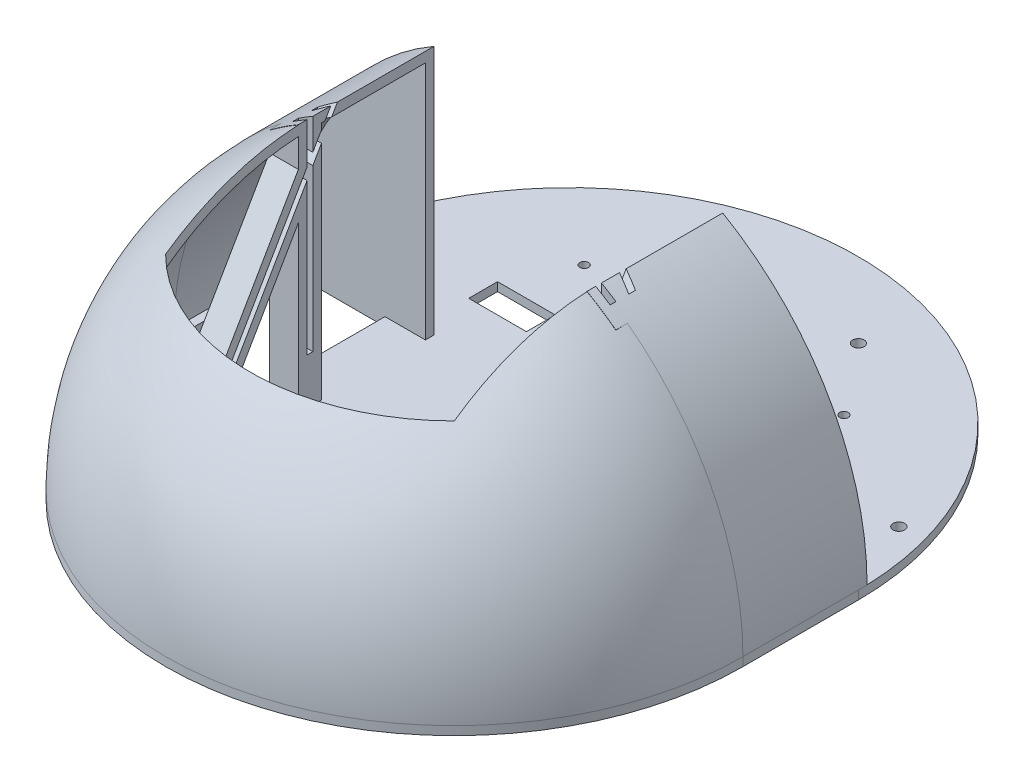
from build123d import *

# Parameters (mm, degrees)
SKETCH_1_R                  = 100
SKETCH_1_W                  = 200
SKETCH_1_H                  = 40
EXTRUDE_524_DEPTH           = 3
SKETCH_3_W                  = 30
SKETCH_3_H                  = 40
SKETCH_3_W_2                = 20
SKETCH_3_H_2                = 10
SKETCH_3_H_3                = 30
CUT_EXTRUDE_1393_DEPTH      = 3
SKETCH_2_R                  = 2
SKETCH_2_R_2                = 1.5
CUT_EXTRUDE_2567_DEPTH      = 173.072659072
REVOLVE_3158_ANGLE          = 90
EXTRUDE_3359_DEPTH          = 40
SKETCH_8_W                  = 10
SKETCH_8_H                  = 8
EXTRUDE_L_DEPTH             = 100
EXTRUDE_L_32_DEPTH          = 10
SKETCH_16_W                 = 2
SKETCH_16_H                 = 84
CUT_EXTRUDE_L_DEPTH         = 5
SKETCH_23_W                 = 200
SKETCH_23_H                 = 3
EXTRUDE_5603_DEPTH          = 100
CUT_EXTRUDE_5983_DEPTH      = 100
CUT_EXTRUDE_5983_DEPTH_BACK = 100
CUT_EXTRUDE_6828_DEPTH      = 100


with BuildPart() as part:
    # 草图1 → Extrude 524 (new body)
    with BuildSketch(Plane(origin=(0, 0, 0), x_dir=(1, 0, 0), z_dir=(0, 1, 0))):
        Circle(SKETCH_1_R)
        with Locations((0, 40)):
            Circle(SKETCH_1_R)
        with Locations((0, 20)):
            Rectangle(SKETCH_1_W, SKETCH_1_H)
    extrude(amount=EXTRUDE_524_DEPTH)

    # 草图3 → Cut-Extrude 1393 (cut)
    with BuildSketch(Plane(origin=(0, 3, 0), x_dir=(1, 0, 0), z_dir=(0, 1, 0))):
        with Locations((-79, 20)):
            Rectangle(SKETCH_3_W, SKETCH_3_H)
        with Locations((79, 20)):
            Rectangle(SKETCH_3_W, SKETCH_3_H)
        with Locations((45, 65)):
            Rectangle(SKETCH_3_W_2, SKETCH_3_H_2)
        with Locations((0, -52)):
            Rectangle(SKETCH_3_W_2, SKETCH_3_H_3)
        with Locations((-45, 65)):
            Rectangle(SKETCH_3_W_2, SKETCH_3_H_2)
    extrude(amount=-CUT_EXTRUDE_1393_DEPTH, mode=Mode.SUBTRACT)

    # 草图2 → Cut-Extrude 2567 (cut, through all)
    with BuildSketch(Plane(origin=(0, 3, 0), x_dir=(1, 0, 0), z_dir=(0, 1, 0))):
        with Locations((-45, -22)):
            Circle(SKETCH_2_R)
        with Locations((-40, -82)):
            Circle(SKETCH_2_R)
        with Locations((-88, 66)):
            Circle(SKETCH_2_R)
        with Locations((-26, 66)):
            Circle(SKETCH_2_R)
        with Locations((-26, 114)):
            Circle(SKETCH_2_R)
        with Locations((40, -82)):
            Circle(SKETCH_2_R)
        with Locations((45, -22)):
            Circle(SKETCH_2_R)
        with Locations((26, 114)):
            Circle(SKETCH_2_R)
        with Locations((26, 66)):
            Circle(SKETCH_2_R)
        with Locations((88, 66)):
            Circle(SKETCH_2_R)
        with Locations((-45, 90)):
            Circle(SKETCH_2_R_2)
        with Locations((45, 90)):
            Circle(SKETCH_2_R_2)
    extrude(amount=-CUT_EXTRUDE_2567_DEPTH, mode=Mode.SUBTRACT)

    # 草图18 → Revolve 3158 (revolve)
    with BuildSketch(Plane(origin=(0, 3, 0), x_dir=(1, 0, 0), z_dir=(0, 1, 0))):
        with BuildLine():
            Line((-97, 0), (-100, 0))
            ThreePointArc((-100, 0), (0, -100), (100, 0))
            Line((100, 0), (97, 0))
            ThreePointArc((97, 0), (0, -97), (-97, 0))
        make_face()
    revolve(axis=Axis((-100, 3, 0), (-1, 0, 0)), revolution_arc=REVOLVE_3158_ANGLE)

    # 草图19 → Extrude 3359 (add)
    with BuildSketch(Plane(origin=(0, 0, 0), x_dir=(-1, 0, 0), z_dir=(0, 0, -1))):
        with BuildLine():
            Line((97, 3), (100, 3))
            ThreePointArc((100, 3), (0, 103), (-100, 3))
            Line((-100, 3), (-97, 3))
            ThreePointArc((-97, 3), (0, 100), (97, 3))
        make_face()
    extrude(amount=EXTRUDE_3359_DEPTH)

    # 草图8 → 安装架-L-树莓派 (add)
    with BuildSketch(Plane(origin=(0, 3, 0), x_dir=(1, 0, 0), z_dir=(0, 1, 0))):
        with Locations((-55, 0)):
            Rectangle(SKETCH_8_W, SKETCH_8_H)
    extrude_l = extrude(amount=EXTRUDE_L_DEPTH)

    # 草图11 → 安装架-L-32 (add)
    with BuildSketch(Plane.ZY.offset(60)):
        Polygon((37, 3), (4, 60.15767665), (3.758069686, 76.576712245), (46.237604307, 3), align=None)
    extrude_l_32 = extrude(amount=-EXTRUDE_L_32_DEPTH)

    # 草图16 → 安装架-L-凹槽 (cut)
    with BuildSketch(Plane(origin=(-50, 0, 0), x_dir=(0, 0, -1), z_dir=(1, 0, 0))):
        Polygon((-32.464101615, 16.856406461), (-34.196152423, 17.856406461), (15.803847577, 104.458946839), (17.535898385, 103.458946839), align=None)
        with Locations((0, 61)):
            Rectangle(SKETCH_16_W, SKETCH_16_H)
    cut_extrude_l = extrude(amount=-CUT_EXTRUDE_L_DEPTH, mode=Mode.SUBTRACT)

    # 安装架-R: 安装架-L-树莓派, 安装架-L-32, 安装架-L-凹槽 across plane
    add(extrude_l.mirror(Plane(origin=(0, 0, 0), x_dir=(0, 0, 1), z_dir=(1, 0, 0))))
    add(extrude_l_32.mirror(Plane(origin=(0, 0, 0), x_dir=(0, 0, 1), z_dir=(1, 0, 0))))
    add(cut_extrude_l.mirror(Plane(origin=(0, 0, 0), x_dir=(0, 0, 1), z_dir=(1, 0, 0))), mode=Mode.SUBTRACT)

    # 草图23 → Extrude 5603 (add)
    with BuildSketch(Plane(origin=(0, 3, 0), x_dir=(1, 0, 0), z_dir=(0, 1, 0))):
        with Locations((0, 41.5)):
            Rectangle(SKETCH_23_W, SKETCH_23_H)
    extrude(amount=EXTRUDE_5603_DEPTH)

    # 草图24 → Cut-Extrude 5983 (cut, two sides: drawn at the far end of the back side and taken through both)
    with BuildSketch(Plane.XY.offset(-40).offset(-CUT_EXTRUDE_5983_DEPTH_BACK)):
        with BuildLine():
            Line((-150, 3), (-100, 3))
            ThreePointArc((-100, 3), (0, 103), (100, 3))
            Line((100, 3), (150, 3))
            ThreePointArc((150, 3), (0, 153), (-150, 3))
        make_face()
    extrude(amount=CUT_EXTRUDE_5983_DEPTH + CUT_EXTRUDE_5983_DEPTH_BACK, mode=Mode.SUBTRACT)

    # 草图21 → Cut-Extrude 6828 (cut)
    with BuildSketch(Plane(origin=(0, 3, 0), x_dir=(1, 0, 0), z_dir=(0, 1, 0))):
        with BuildLine():
            Line((50, -50), (50, 50))
            Line((50, 50), (-50, 50))
            Line((-50, 50), (-50, -50))
            ThreePointArc((-50, -50), (0, -70.710678119), (50, -50))
        make_face()
    extrude(amount=CUT_EXTRUDE_6828_DEPTH, mode=Mode.SUBTRACT)


solid = part.part
